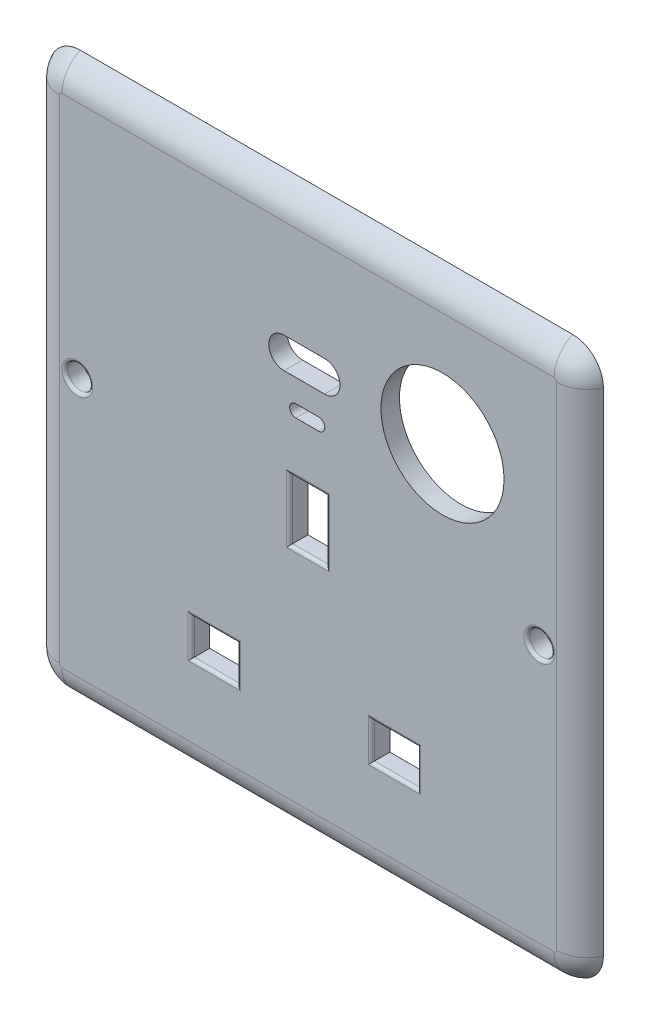
from build123d import *

# Parameters (mm, degrees)
SKETCH1_W           = 90
SKETCH1_H           = 90
BOSS_EXTRUDE5_DEPTH = 3
FILLET14_R          = 5
FILLET15_R          = 5
SKETCH17_R          = 10
SKETCH17_R_2        = 2
SKETCH17_W          = 7.5
SKETCH17_H          = 6
SKETCH17_W_2        = 6
SKETCH17_H_2        = 10
CUT_EXTRUDE4_DEPTH  = 3
FILLET16_R          = 0.5


with BuildPart() as part:
    # Sketch1 → Boss-Extrude5 (new body)
    with BuildSketch(Plane.XY):
        with Locations((55.696781823, -9)):
            Rectangle(SKETCH1_W, SKETCH1_H)
    extrude(amount=BOSS_EXTRUDE5_DEPTH)

    # Fillet14
    fillet14_edges = [part.edges().sort_by_distance(p)[0] for p in [
        (10.696781823, 36, 1.5),
        (100.696781823, 36, 1.5),
        (100.696781823, -54, 1.5),
        (10.696781823, -54, 1.5),
    ]]
    fillet(fillet14_edges, radius=FILLET14_R)

    # Fillet15
    # the kernel refuses this fillet: 5 mm, written as the material it takes off along each edge
    with BuildSketch(Plane(origin=(15.696781823, 31, 3), x_dir=(0, 1, 0), z_dir=(1, 0, 0))) as fillet15_piece_1:
        with BuildLine():
            CenterArc((0.417424305, -5), FILLET15_R, 23.578178478, 66.421821522)
            Line((0.417424305, 0), (0.417424305, 0.1))
            Line((0.417424305, 0.1), (5, 0.1))
            Line((5, 0.1), (5.1, 0))
            ThreePointArc((5.1, 0), (5.1, -1.5), (5.091651514, -2.96))
            Line((5.091651514, -2.96), (5, -3))
        make_face()
    revolve(axis=Axis((15.696781823, 31, 3), (0, 0, 1)), revolution_arc=90, mode=Mode.SUBTRACT)
    with BuildSketch(Plane(origin=(15.696781823, 36, 3), x_dir=(0, 0, -1), z_dir=(1, 0, 0))) as fillet15_piece_2:
        with BuildLine():
            CenterArc((5, -4.582575695), FILLET15_R, 113.578178478, 66.421821522)
            Line((0, -4.582575695), (-0.1, -4.582575695))
            Line((-0.1, -4.582575695), (-0.1, 0))
            Line((-0.1, 0), (0, 0.1))
            ThreePointArc((0, 0.1), (1.5, 0.1), (2.96, 0.091651514))
            Line((2.96, 0.091651514), (3, 0))
        make_face()
    extrude(amount=80, mode=Mode.SUBTRACT)
    with BuildSketch(Plane(origin=(95.696781823, 31, 3), x_dir=(0, 1, 0), z_dir=(-1, 0, 0))) as fillet15_piece_3:
        with BuildLine():
            CenterArc((0.417424305, 5), FILLET15_R, 270, 66.421821522)
            Line((0.417424305, 0), (0.417424305, -0.1))
            Line((0.417424305, -0.1), (5, -0.1))
            Line((5, -0.1), (5.1, 0))
            ThreePointArc((5.1, 0), (5.1, 1.5), (5.091651514, 2.96))
            Line((5.091651514, 2.96), (5, 3))
        make_face()
    revolve(axis=Axis((95.696781823, 31, 3), (0, 0, -1)), revolution_arc=90, mode=Mode.SUBTRACT)
    with BuildSketch(Plane(origin=(100.696781823, 31, 3), x_dir=(-1, 0, 0), z_dir=(0, -1, 0)), Plane(origin=(95.696781823, -54, 3), x_dir=(0, 1, 0), z_dir=(-1, 0, 0)), Plane(origin=(10.696781823, -49, 3), x_dir=(1, 0, 0), z_dir=(0, 1, 0))) as fillet15_piece_4:
        with BuildLine():
            CenterArc((4.582575695, 5), FILLET15_R, 203.578178478, 66.421821522)
            Line((0, 3), (-0.091651514, 2.96))
            ThreePointArc((-0.091651514, 2.96), (-0.1, 1.5), (-0.1, 0))
            Line((-0.1, 0), (0, -0.1))
            Line((0, -0.1), (4.582575695, -0.1))
            Line((4.582575695, -0.1), (4.582575695, 0))
        make_face()
    extrude(amount=80, mode=Mode.SUBTRACT)
    with BuildSketch(Plane(origin=(95.696781823, -49, 3), x_dir=(1, 0, 0), z_dir=(0, 1, 0))) as fillet15_piece_5:
        with BuildLine():
            CenterArc((0.417424305, 5), FILLET15_R, 270, 66.421821522)
            Line((5, 3), (5.091651514, 2.96))
            ThreePointArc((5.091651514, 2.96), (5.1, 1.5), (5.1, 0))
            Line((5.1, 0), (5, -0.1))
            Line((5, -0.1), (0.417424305, -0.1))
            Line((0.417424305, -0.1), (0.417424305, 0))
        make_face()
    revolve(axis=Axis((95.696781823, -49, 3), (0, 0, -1)), revolution_arc=90, mode=Mode.SUBTRACT)
    with BuildSketch(Plane(origin=(15.696781823, -49, 3), x_dir=(0, -1, 0), z_dir=(1, 0, 0))) as fillet15_piece_6:
        with BuildLine():
            CenterArc((0.417424305, 5), FILLET15_R, 270, 66.421821522)
            Line((5, 3), (5.091651514, 2.96))
            ThreePointArc((5.091651514, 2.96), (5.1, 1.5), (5.1, 0))
            Line((5.1, 0), (5, -0.1))
            Line((5, -0.1), (0.417424305, -0.1))
            Line((0.417424305, -0.1), (0.417424305, 0))
        make_face()
    revolve(axis=Axis((15.696781823, -49, 3), (0, 0, -1)), revolution_arc=90, mode=Mode.SUBTRACT)

    # Sketch17 → Cut-Extrude4 (cut)
    with BuildSketch(Plane.XY.offset(3)):
        with Locations((77.551683104, 13.009941811)):
            Circle(SKETCH17_R)
        with Locations((18.19937678, -7.407199345)):
            Circle(SKETCH17_R_2)
        with Locations((93.263694242, -7.407199345)):
            Circle(SKETCH17_R_2)
        with Locations((69.739484947, -34.653171103)):
            Rectangle(SKETCH17_W, SKETCH17_H)
        with Locations((55.687795517, -8.716286613)):
            Rectangle(SKETCH17_W_2, SKETCH17_H_2)
        with Locations((40.465326937, -34.674989483)):
            Rectangle(SKETCH17_W, SKETCH17_H)
        with BuildLine():
            Line((53.707261797, 6.745948723), (57.423415647, 6.745948723))
            ThreePointArc((57.423415647, 6.745948723), (58.423415647, 5.745948723), (57.423415647, 4.745948723))
            Line((57.423415647, 4.745948723), (53.707261797, 4.745948723))
            ThreePointArc((53.707261797, 4.745948723), (52.707261797, 5.745948723), (53.707261797, 6.745948723))
        make_face()
        with BuildLine():
            Line((51.807146289, 15.44525347), (58.394003545, 15.44525347))
            ThreePointArc((58.394003545, 15.44525347), (60.894003545, 12.94525347), (58.394003545, 10.44525347))
            Line((58.394003545, 10.44525347), (51.807146289, 10.44525347))
            ThreePointArc((51.807146289, 10.44525347), (49.307146289, 12.94525347), (51.807146289, 15.44525347))
        make_face()
    extrude(amount=-CUT_EXTRUDE4_DEPTH, mode=Mode.SUBTRACT)

    # Fillet16
    fillet16_edges = [part.edges().sort_by_distance(p)[0] for p in [
        (16.19937678, -7.407199345, 3),
        (91.263694242, -7.407199345, 3),
        (52.687795517, -8.716286613, 3),
        (55.687795517, -13.716286613, 3),
        (58.687795517, -8.716286613, 3),
        (55.687795517, -3.716286613, 3),
        (36.715326937, -34.674989483, 3),
        (40.465326937, -37.674989483, 3),
        (44.215326937, -34.674989483, 3),
        (40.465326937, -31.674989483, 3),
        (65.989484947, -34.653171103, 3),
        (69.739484947, -37.653171103, 3),
        (73.489484947, -34.653171103, 3),
        (69.739484947, -31.653171103, 3),
    ]]
    fillet(fillet16_edges, radius=FILLET16_R)


solid = part.part
